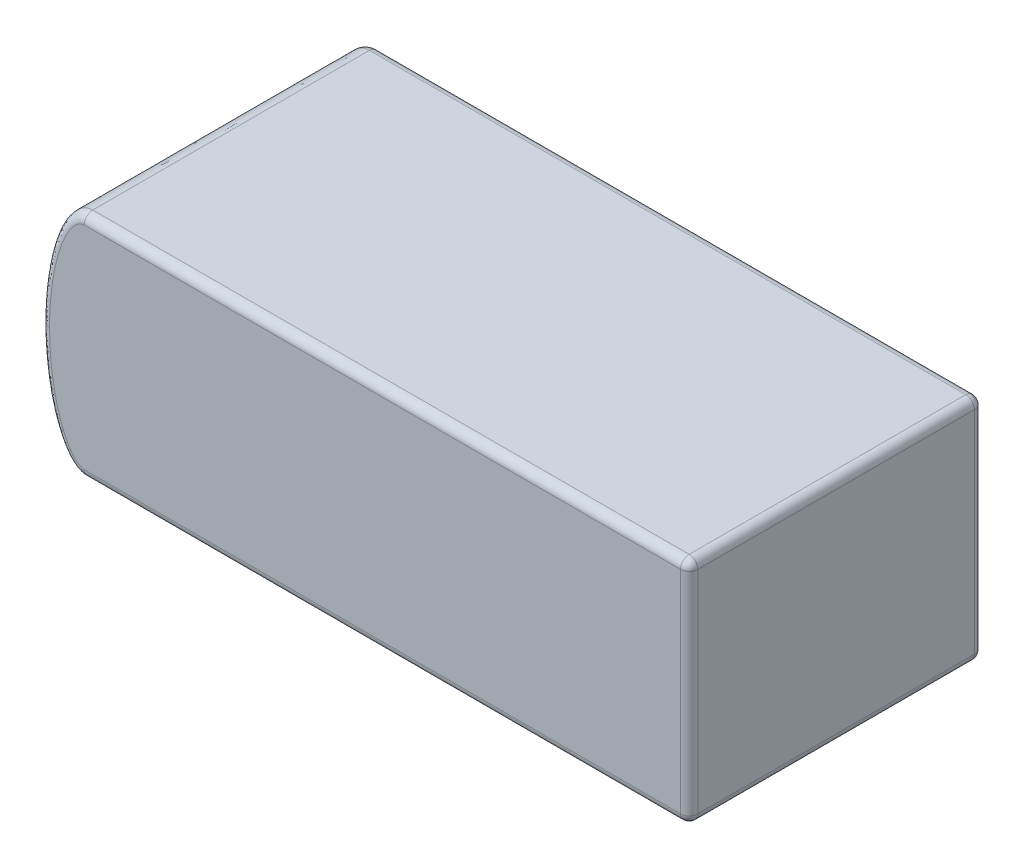
from build123d import *

# Parameters (mm, degrees)
SKETCH1_W           = 75
SKETCH1_H           = 34
BOSS_EXTRUDE1_DEPTH = 26.5
FILLET3_SIZE        = 13.25
FILLET3_SIZE_2      = 5
FILLET4_R           = 1


with BuildPart() as part:
    # Sketch1 → Boss-Extrude1 (new body)
    with BuildSketch(Plane(origin=(0, 0, 0), x_dir=(1, 0, 0), z_dir=(0, 1, 0))):
        Rectangle(SKETCH1_W, SKETCH1_H)
    extrude(amount=BOSS_EXTRUDE1_DEPTH)

    # Fillet3
    # an asymmetric fillet: 13.25, 5 mm, written as the material it takes off along each edge
    with BuildSketch(Plane(origin=(-37.5, 0, -50.125), x_dir=(0, 1, 0), z_dir=(0, 0, 1))) as fillet3_piece_1:
        with BuildLine():
            Bezier((FILLET3_SIZE, 0), (0, 0), (0, -FILLET3_SIZE_2), weights=[1, 0.707106781, 1])
            Line((0, -FILLET3_SIZE_2), (0, 0))
            Line((0, 0), (FILLET3_SIZE, 0))
        make_face()
    extrude(amount=100.25, mode=Mode.SUBTRACT)
    with BuildSketch(Plane(origin=(-37.5, 26.5, -50.125), x_dir=(0, -1, 0), z_dir=(0, 0, 1))) as fillet3_piece_2:
        with BuildLine():
            Bezier((FILLET3_SIZE, 0), (0, 0), (0, FILLET3_SIZE_2), weights=[1, 0.707106781, 1])
            Line((0, FILLET3_SIZE_2), (0, 0))
            Line((0, 0), (FILLET3_SIZE, 0))
        make_face()
    extrude(amount=100.25, mode=Mode.SUBTRACT)

    # Fillet4
    fillet4_edges = [part.edges().sort_by_distance(p)[0] for p in [
        (-36.630115915, 5.781821135, 17),
        (-36.630115915, 5.781821135, -17),
        (37.5, 13.25, 17),
        (37.5, 13.25, -17),
        (37.5, 0, 0),
        (2.5, 0, -17),
        (2.5, 0, 17),
        (37.5, 26.5, 0),
        (2.5, 26.5, 17),
        (2.5, 26.5, -17),
        (-36.630115915, 20.718178865, 17),
        (-36.630115915, 20.718178865, -17),
    ]]
    fillet(fillet4_edges, radius=FILLET4_R)


solid = part.part
